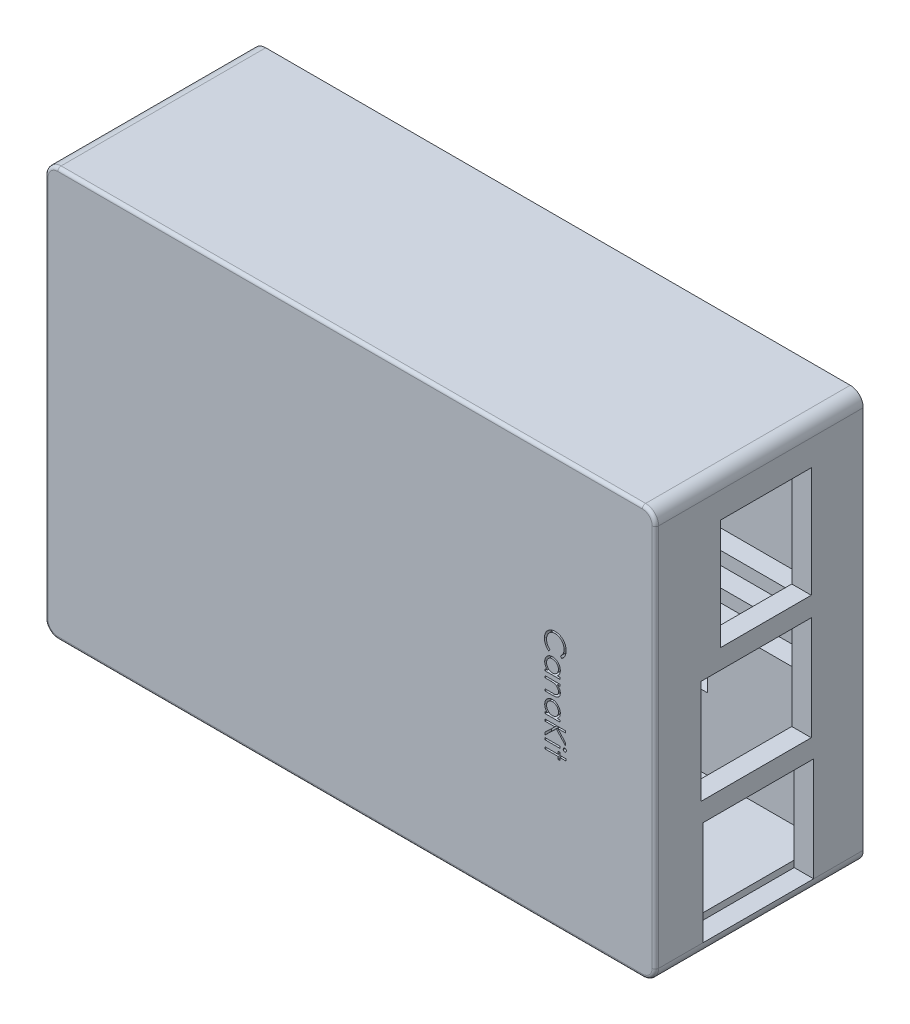
from build123d import *

# Parameters (mm, degrees)
SKETCH1_W           = 94
SKETCH1_H           = 63
BOSS_EXTRUDE1_DEPTH = 32
SHELL1_T            = 3
SKETCH2_W           = 8
SKETCH2_H           = 17
CUT_EXTRUDE1_DEPTH  = 3
SKETCH3_W           = 14
SKETCH3_H           = 17
CUT_EXTRUDE2_DEPTH  = 3
SKETCH4_W           = 17
SKETCH4_H           = 16
CUT_EXTRUDE4_DEPTH  = 3
SKETCH5_W           = 17
SKETCH5_H           = 16
CUT_EXTRUDE5_DEPTH  = 3
SKETCH6_R           = 1.75
CUT_EXTRUDE6_DEPTH  = 3
SKETCH7_W           = 9
SKETCH7_H           = 3
SKETCH7_W_2         = 8
SKETCH7_H_2         = 2.5
CUT_EXTRUDE7_DEPTH  = 3
SKETCH9_W           = 2.320192308
SKETCH9_H           = 0.284935898
CUT_EXTRUDE8_DEPTH  = 1
SKETCH11_W          = 0.237446581
SKETCH11_H          = 2.645833333
SKETCH11_W_2        = 0.237446582
CUT_EXTRUDE9_DEPTH  = 1
SKETCH14_W          = 50
SKETCH14_H          = 3
SKETCH14_W_2        = 60
SKETCH14_W_3        = 76
CUT_EXTRUDE11_DEPTH = 10
FILLET1_R           = 2
FILLET2_R           = 0.5


with BuildPart() as part:
    # Sketch1 → Boss-Extrude1 (new body)
    with BuildSketch(Plane.XY):
        with Locations((47, 31.5)):
            Rectangle(SKETCH1_W, SKETCH1_H)
    extrude(amount=BOSS_EXTRUDE1_DEPTH)

    # Shell1 (no face opened: a closed hollow body)
    add(offset(amount=-SHELL1_T, mode=Mode.PRIVATE), mode=Mode.SUBTRACT)

    # Sketch2 → Cut-Extrude1 (cut)
    with BuildSketch(Plane.ZY):
        with Locations((4, 31.5)):
            Rectangle(SKETCH2_W, SKETCH2_H)
    extrude(amount=-CUT_EXTRUDE1_DEPTH, mode=Mode.SUBTRACT)

    # Sketch3 → Cut-Extrude2 (cut)
    with BuildSketch(Plane(origin=(94, 0, 0), x_dir=(0, 0, -1), z_dir=(1, 0, 0))):
        with Locations((-15, 48.5)):
            Rectangle(SKETCH3_W, SKETCH3_H)
    extrude(amount=-CUT_EXTRUDE2_DEPTH, mode=Mode.SUBTRACT)

    # Sketch4 → Cut-Extrude4 (cut)
    with BuildSketch(Plane(origin=(94, 0, 0), x_dir=(0, 0, -1), z_dir=(1, 0, 0))):
        with Locations((-16.5, 29)):
            Rectangle(SKETCH4_W, SKETCH4_H)
    extrude(amount=-CUT_EXTRUDE4_DEPTH, mode=Mode.SUBTRACT)

    # Sketch5 → Cut-Extrude5 (cut)
    with BuildSketch(Plane(origin=(94, 0, 0), x_dir=(0, 0, -1), z_dir=(1, 0, 0))):
        with Locations((-16.132814298, 10)):
            Rectangle(SKETCH5_W, SKETCH5_H)
    extrude(amount=-CUT_EXTRUDE5_DEPTH, mode=Mode.SUBTRACT)

    # Sketch6 → Cut-Extrude6 (cut)
    with BuildSketch(Plane(origin=(0, 0, 0), x_dir=(-1, 0, 0), z_dir=(0, -1, 0))):
        with Locations(Location((-59, -11, 0), (0, 0, 90))):
            Circle(SKETCH6_R)
    extrude(amount=-CUT_EXTRUDE6_DEPTH, mode=Mode.SUBTRACT)

    # Sketch7 → Cut-Extrude7 (cut)
    with BuildSketch(Plane(origin=(0, 0, 0), x_dir=(-1, 0, 0), z_dir=(0, -1, 0))):
        with Locations((-47.5, -9.5)):
            Rectangle(SKETCH7_W, SKETCH7_H)
        with Locations((-32.5, -9.5)):
            Rectangle(SKETCH7_W, SKETCH7_H)
        with Locations((-18, -9.25)):
            Rectangle(SKETCH7_W_2, SKETCH7_H_2)
    extrude(amount=-CUT_EXTRUDE7_DEPTH, mode=Mode.SUBTRACT)

    # Sketch9 → Cut-Extrude8 (cut)
    # profile 1 of 8: a face of its own
    with BuildSketch(Plane.XY.offset(32)):
        with BuildLine():
            Line((79.592407853, 36.364576199), (79.401602564, 36.61389511))
            add(Edge.make_bspline(
                [(79.401602564, 36.61389511), (79.422798837, 36.631680451), (79.46490561, 36.667011349), (79.524032768, 36.723852197), (79.579427684, 36.783090116), (79.631354246, 36.844702462), (79.677996598, 36.909798235), (79.721785384, 36.976800531), (79.761035404, 37.046830186), (79.808626827, 37.143669259), (79.85828941, 37.270349808), (79.899930199, 37.42982084), (79.92643798, 37.596291622), (79.929308943, 37.709863731), (79.930769231, 37.767631087)],
                knots=[0, 0, 0, 0, 0.757959112, 1.505699292, 2.245454638, 2.979532153, 3.711538275, 4.438200793, 5.171680507, 5.909471876, 7.393775596, 8.890124382, 10.418191784, 12, 12, 12, 12], degree=3))
            add(Edge.make_bspline(
                [(79.930769231, 37.767631087), (79.930401126, 37.799456265), (79.929668331, 37.862811252), (79.920068742, 37.956840934), (79.906421017, 38.049292881), (79.886663101, 38.139823299), (79.860940087, 38.228252435), (79.830773858, 38.315253604), (79.793235048, 38.399802163), (79.751778443, 38.482915634), (79.704940099, 38.562540242), (79.653867717, 38.637894764), (79.599062564, 38.708634942), (79.54066611, 38.774956797), (79.477952603, 38.836132968), (79.411659795, 38.893143893), (79.340989768, 38.944962102), (79.267267879, 38.992860937), (79.190385773, 39.035482334), (79.1108271, 39.072287973), (79.028896043, 39.103833466), (78.944424761, 39.129026049), (78.857745669, 39.148897012), (78.768674814, 39.162624777), (78.677385087, 39.17213801), (78.615509579, 39.172864063), (78.584319912, 39.173230045)],
                knots=[0, 0, 0, 0, 1.055000685, 2.100209969, 3.131349012, 4.153242145, 5.170189196, 6.184191144, 7.204341339, 8.235672124, 9.263040994, 10.265373269, 11.252624173, 12.22887325, 13.193405896, 14.155809299, 15.126090485, 16.097288279, 17.069732292, 18.038585918, 19.002221264, 19.978698174, 20.959418239, 21.948869816, 22.966084182, 24, 24, 24, 24], degree=3))
            add(Edge.make_bspline(
                [(78.584319912, 39.173230045), (78.537392215, 39.172085395), (78.445255905, 39.169838027), (78.310299709, 39.149837038), (78.181013097, 39.119443134), (78.058204241, 39.073890432), (77.940358801, 39.017721007), (77.829470699, 38.946745595), (77.723864244, 38.864543451), (77.626035284, 38.769951656), (77.536669262, 38.666169237), (77.457974091, 38.554819346), (77.392374162, 38.436179314), (77.337785982, 38.311559085), (77.295824522, 38.179999681), (77.26628421, 38.041737682), (77.247014518, 37.897073801), (77.245169672, 37.798222988), (77.244230769, 37.747914541)],
                knots=[0, 0, 0, 0, 1.029171465, 2.020641659, 2.987623507, 3.938342917, 4.889210282, 5.84687017, 6.821220943, 7.821438502, 8.827599549, 9.822697543, 10.807740252, 11.797342354, 12.80366471, 13.83203677, 14.896651826, 16, 16, 16, 16], degree=3))
            add(Edge.make_bspline(
                [(77.244230769, 37.747914541), (77.245762734, 37.692485673), (77.248778006, 37.583388401), (77.274322468, 37.423397406), (77.315740722, 37.270239247), (77.373705266, 37.123905686), (77.449057348, 36.984809257), (77.540404709, 36.852732287), (77.648616268, 36.727563291), (77.731241677, 36.652296485), (77.773397436, 36.61389511)],
                knots=[0, 0, 0, 0, 1.028121516, 2.023589091, 2.998037872, 3.967518031, 4.937445131, 5.927275754, 6.942489185, 8, 8, 8, 8], degree=3))
            Line((77.773397436, 36.61389511), (77.5845002, 36.364576199))
            add(Edge.make_bspline(
                [(77.5845002, 36.364576199), (77.558611703, 36.384640458), (77.506958714, 36.424672869), (77.434141462, 36.489495894), (77.365646064, 36.557781681), (77.302039415, 36.630046279), (77.241993661, 36.705425405), (77.187521789, 36.785246822), (77.136964496, 36.868131861), (77.091284016, 36.95456309), (77.050326453, 37.044256744), (77.015748946, 37.13711948), (76.985534654, 37.232364561), (76.960842027, 37.330039952), (76.941538282, 37.430471959), (76.928641156, 37.533315999), (76.919803267, 37.638789163), (76.91899788, 37.709946769), (76.918589744, 37.746006488)],
                knots=[0, 0, 0, 0, 0.986756325, 1.968786143, 2.935506311, 3.899499537, 4.868307269, 5.8376204, 6.809456583, 7.792545619, 8.781780509, 9.778496008, 10.776623214, 11.79151764, 12.812666265, 13.856269958, 14.913646641, 16, 16, 16, 16], degree=3))
            add(Edge.make_bspline(
                [(76.918589744, 37.746006488), (76.918827408, 37.780154671), (76.919297361, 37.847678476), (76.926910255, 37.947372344), (76.937296803, 38.044427178), (76.952936064, 38.138565588), (76.971391287, 38.230301294), (76.996130213, 38.318802682), (77.023842671, 38.404940622), (77.056413623, 38.488369046), (77.093167589, 38.569158916), (77.134707074, 38.647049659), (77.180682766, 38.722005452), (77.23008124, 38.794763226), (77.284489221, 38.864248177), (77.343151096, 38.931062447), (77.405869149, 38.995580693), (77.451094623, 39.035497414), (77.473833133, 39.055566784)],
                knots=[0, 0, 0, 0, 1.114604814, 2.203992996, 3.262667896, 4.300477797, 5.318619304, 6.316056647, 7.298880507, 8.271930387, 9.238335007, 10.195173496, 11.151986948, 12.108099108, 13.064862484, 14.031167946, 15.010108607, 16, 16, 16, 16], degree=3))
            add(Edge.make_bspline(
                [(77.473833133, 39.055566784), (77.513331212, 39.087711975), (77.591850513, 39.151614272), (77.719109939, 39.233371142), (77.851977528, 39.303354996), (77.991151321, 39.359938867), (78.136319022, 39.404173632), (78.28755381, 39.434818002), (78.444714444, 39.454731243), (78.551609245, 39.457008433), (78.605944511, 39.458165943)],
                knots=[0, 0, 0, 0, 0.994628077, 1.977248131, 2.950237994, 3.925870899, 4.908910175, 5.911660606, 6.938484602, 8, 8, 8, 8], degree=3))
            add(Edge.make_bspline(
                [(78.605944511, 39.458165943), (78.663051712, 39.45674885), (78.775406564, 39.453960809), (78.94033561, 39.43046897), (79.098121922, 39.392219718), (79.249372626, 39.339550243), (79.393222321, 39.270065123), (79.530278547, 39.185947766), (79.660429392, 39.086376549), (79.782010866, 38.972601991), (79.893168603, 38.847802191), (79.990965005, 38.7141647), (80.072351404, 38.571940624), (80.140383692, 38.422699551), (80.19267544, 38.265323221), (80.229281549, 38.100147603), (80.252066361, 37.927483013), (80.254946728, 37.809679242), (80.256410256, 37.749822594)],
                knots=[0, 0, 0, 0, 1.032901378, 2.032168977, 3.007206631, 3.966850309, 4.924221947, 5.891988639, 6.871730993, 7.884084801, 8.900290346, 9.89161143, 10.874607481, 11.860025555, 12.854717796, 13.869097222, 14.917278314, 16, 16, 16, 16], degree=3))
            add(Edge.make_bspline(
                [(80.256410256, 37.749822594), (80.255973215, 37.713342251), (80.255108136, 37.641133087), (80.246661398, 37.534315646), (80.232605758, 37.430314869), (80.213348582, 37.328879244), (80.189745739, 37.229640947), (80.158847794, 37.133618086), (80.122967705, 37.040287782), (80.082697452, 36.949580136), (80.036659325, 36.862482019), (79.986657094, 36.779009281), (79.931536539, 36.70016887), (79.873119948, 36.624477791), (79.809222157, 36.55364009), (79.741924047, 36.48563266), (79.669228646, 36.422804733), (79.618061659, 36.384021241), (79.592407853, 36.364576199)],
                knots=[0, 0, 0, 0, 1.096705196, 2.170817488, 3.219277236, 4.250701065, 5.274195539, 6.284202015, 7.28098643, 8.279664616, 9.266225751, 10.241373748, 11.203306326, 12.157093976, 13.114198862, 14.069774147, 15.032234603, 16, 16, 16, 16], degree=3))
        make_face()
    # profile 2 of 8: a face of its own
    with BuildSketch(Plane.XY.offset(32)):
        with BuildLine():
            Line((79.320192308, 33.433806969), (77, 33.433806969))
            Line((77, 33.433806969), (77, 33.718742866))
            Line((77, 33.718742866), (77.401327123, 33.718742866))
            add(Edge.make_bspline(
                [(77.401327123, 33.718742866), (77.364995688, 33.75086605), (77.294094435, 33.813554849), (77.201743879, 33.918239121), (77.124780832, 34.028742835), (77.063197788, 34.145439663), (77.01658663, 34.267980451), (76.983808313, 34.396015744), (76.962470523, 34.529374903), (76.960362919, 34.62032125), (76.959294872, 34.666409132)],
                knots=[0, 0, 0, 0, 1.074295371, 2.096500925, 3.086030275, 4.053105238, 5.014108356, 5.985331429, 6.979048527, 8, 8, 8, 8], degree=3))
            add(Edge.make_bspline(
                [(76.959294872, 34.666409132), (76.960407182, 34.70738303), (76.962600707, 34.788185371), (76.979623451, 34.907045862), (77.006946428, 35.021435457), (77.044992597, 35.13142706), (77.095199127, 35.236275388), (77.155955963, 35.336571232), (77.227599005, 35.432548666), (77.309821196, 35.5223824), (77.399031733, 35.605211329), (77.494459932, 35.677678276), (77.594795087, 35.739096373), (77.700008999, 35.789571049), (77.810024757, 35.828631), (77.924766887, 35.855806157), (78.044044465, 35.872810557), (78.12526995, 35.875002971), (78.16645633, 35.876114661)],
                knots=[0, 0, 0, 0, 1.034036272, 2.039165313, 3.024406509, 3.999331371, 4.971254918, 5.953351348, 6.95522652, 7.989525907, 9.023492927, 10.024309745, 11.009187477, 11.988246066, 12.964946762, 13.950187958, 14.960617622, 16, 16, 16, 16], degree=3))
            add(Edge.make_bspline(
                [(78.16645633, 35.876114661), (78.206791433, 35.874978314), (78.286531756, 35.872731817), (78.403803519, 35.855988109), (78.516768542, 35.827853322), (78.625008361, 35.788294483), (78.728958893, 35.737792967), (78.827806828, 35.675318617), (78.92306426, 35.602877784), (79.011676453, 35.519163623), (79.093231565, 35.428523599), (79.165048714, 35.33200918), (79.225649774, 35.230823806), (79.274912545, 35.124764585), (79.314059741, 35.014582511), (79.341349107, 34.899440589), (79.357390885, 34.779862438), (79.359717355, 34.69868263), (79.360897436, 34.657504885)],
                knots=[0, 0, 0, 0, 1.02050356, 2.017480486, 2.990790918, 3.96161403, 4.928589988, 5.909588639, 6.91611943, 7.952353252, 8.989586576, 9.99823133, 10.991940466, 11.968822692, 12.952985106, 13.945868367, 14.958059758, 16, 16, 16, 16], degree=3))
            add(Edge.make_bspline(
                [(79.360897436, 34.657504885), (79.35959954, 34.610150313), (79.357054429, 34.517290231), (79.335648743, 34.381289209), (79.299929904, 34.252512878), (79.250839162, 34.130218955), (79.186088065, 34.014881847), (79.103669958, 33.907921046), (79.005467682, 33.807183259), (78.929818802, 33.748796176), (78.890880409, 33.718742866)],
                knots=[0, 0, 0, 0, 1.03879612, 2.037030165, 3.012306674, 3.966139504, 4.922386257, 5.905048148, 6.921675258, 8, 8, 8, 8], degree=3))
            Line((78.890880409, 33.718742866), (79.320192308, 33.718742866))
            Line((79.320192308, 33.718742866), (79.320192308, 33.433806969))
        make_face()
        with BuildLine():
            add(Edge.make_bspline(
                [(79.075961538, 34.653688779), (79.074479612, 34.695339668), (79.071554524, 34.777551898), (79.048718337, 34.898241451), (79.010723893, 35.013734268), (78.958757765, 35.123444511), (78.893429501, 35.225669681), (78.814353247, 35.316942945), (78.724043657, 35.398356292), (78.621741454, 35.465667444), (78.513319241, 35.522417441), (78.399120862, 35.561333849), (78.282314515, 35.587230091), (78.203058982, 35.589859112), (78.163276242, 35.591178763)],
                knots=[0, 0, 0, 0, 1.031093775, 2.03521511, 3.029845951, 4.035119871, 5.034286494, 6.024708811, 7.017619509, 8.03559408, 9.050082311, 10.039808432, 11.016071318, 12, 12, 12, 12], degree=3))
            add(Edge.make_bspline(
                [(78.163276242, 35.591178763), (78.123739082, 35.589471444), (78.044819734, 35.586063497), (77.927666339, 35.562016456), (77.813927693, 35.520351084), (77.704003595, 35.464896412), (77.601491403, 35.396075419), (77.509415819, 35.315337749), (77.430022437, 35.222900584), (77.363570151, 35.120453679), (77.31007922, 35.01120177), (77.272360445, 34.89625621), (77.248543069, 34.777636627), (77.245673038, 34.6968369), (77.244230769, 34.65623285)],
                knots=[0, 0, 0, 0, 0.979154363, 1.954470772, 2.947816011, 3.971783346, 4.997163654, 5.998045606, 6.995988793, 8.00538986, 9.015323546, 10.000094788, 10.994993517, 12, 12, 12, 12], degree=3))
            add(Edge.make_bspline(
                [(77.244230769, 34.65623285), (77.245714042, 34.615001481), (77.248656622, 34.53320494), (77.271874718, 34.412231326), (77.309396751, 34.294652065), (77.36210666, 34.182216186), (77.427132861, 34.077551449), (77.503594937, 33.983732822), (77.591774751, 33.903622309), (77.689464359, 33.836464479), (77.796058113, 33.78341316), (77.910031357, 33.745995378), (78.030488427, 33.723013869), (78.112927573, 33.720186219), (78.155008013, 33.718742866)],
                knots=[0, 0, 0, 0, 1.017484689, 2.018529338, 3.030031036, 4.058138743, 5.076350332, 6.065651025, 7.036469986, 8.00785331, 8.984076697, 9.96571663, 10.961615403, 12, 12, 12, 12], degree=3))
            add(Edge.make_bspline(
                [(78.155008013, 33.718742866), (78.187064461, 33.719613425), (78.250161695, 33.721326961), (78.34280612, 33.734417353), (78.431463925, 33.75524147), (78.516232148, 33.784581448), (78.596628012, 33.823136852), (78.67328171, 33.869589193), (78.745479223, 33.924891278), (78.813129118, 33.987360122), (78.874523952, 34.056508928), (78.928636843, 34.130039722), (78.974431239, 34.2077675), (79.011078734, 34.289637702), (79.040934529, 34.375019758), (79.060653765, 34.464732039), (79.074237276, 34.557870409), (79.075380733, 34.621413033), (79.075961538, 34.653688779)],
                knots=[0, 0, 0, 0, 1.050062701, 2.066855696, 3.059271411, 4.030305351, 4.999747758, 5.975466543, 6.961907836, 7.974539719, 8.98812422, 9.98710676, 10.961662635, 11.93785114, 12.922015094, 13.919620009, 14.94329489, 16, 16, 16, 16], degree=3))
        make_face(mode=Mode.SUBTRACT)
    # profile 3 of 8: a face of its own
    with BuildSketch(Plane.XY.offset(32)):
        with BuildLine():
            Line((79.320192308, 32.782524917), (79.320192308, 32.49758902))
            Line((79.320192308, 32.49758902), (78.901692708, 32.49758902))
            add(Edge.make_bspline(
                [(78.901692708, 32.49758902), (78.939650035, 32.467165594), (79.013307553, 32.408127874), (79.11011836, 32.3098078), (79.189897243, 32.205900119), (79.253491399, 32.097041159), (79.301430838, 31.983083142), (79.33605279, 31.864720712), (79.356812599, 31.741245228), (79.359525165, 31.657276061), (79.360897436, 31.614796552)],
                knots=[0, 0, 0, 0, 1.12780773, 2.188550248, 3.19190651, 4.159438251, 5.104880172, 6.052711206, 7.014878035, 8, 8, 8, 8], degree=3))
            add(Edge.make_bspline(
                [(79.360897436, 31.614796552), (79.359311939, 31.571862065), (79.356208739, 31.487828919), (79.331733941, 31.365458896), (79.289686849, 31.25106759), (79.232671944, 31.144905591), (79.161388453, 31.049412476), (79.077897152, 30.966307542), (78.982598051, 30.896985598), (78.893915897, 30.850576457), (78.815281557, 30.819977568), (78.747928028, 30.800717955), (78.67289119, 30.784360928), (78.590395887, 30.770180807), (78.499864703, 30.760585823), (78.401668573, 30.753018182), (78.295839357, 30.74759465), (78.222645059, 30.747379469), (78.184900841, 30.747268507)],
                knots=[0, 0, 0, 0, 1.235764744, 2.418689688, 3.575570385, 4.733739044, 5.876600945, 6.994686206, 8.113221397, 9.257403329, 9.866223892, 10.540462211, 11.272173464, 12.077110251, 12.949508505, 13.892531187, 14.913238277, 16, 16, 16, 16], degree=3))
            Line((78.184900841, 30.747268507), (77, 30.747268507))
            Line((77, 30.747268507), (77, 31.032204404))
            Line((77, 31.032204404), (78.09140625, 31.032204404))
            add(Edge.make_bspline(
                [(78.09140625, 31.032204404), (78.122995182, 31.032379672), (78.183419433, 31.032714928), (78.269932762, 31.033772336), (78.348388443, 31.036321232), (78.418598912, 31.039902916), (78.48049675, 31.045145322), (78.534208022, 31.050608709), (78.579664536, 31.057289795), (78.607028575, 31.063243295), (78.619300881, 31.065913339)],
                knots=[0, 0, 0, 0, 1.430800155, 2.736877192, 3.918605307, 4.986035426, 5.920637409, 6.731861385, 7.431261377, 8, 8, 8, 8], degree=3))
            add(Edge.make_bspline(
                [(78.619300881, 31.065913339), (78.655324599, 31.075552214), (78.72465911, 31.094104066), (78.818706559, 31.139945608), (78.898714915, 31.197834186), (78.964189512, 31.268498664), (79.015144486, 31.351256468), (79.05049943, 31.445877948), (79.072612189, 31.55145), (79.074813944, 31.625703619), (79.075961538, 31.664405927)],
                knots=[0, 0, 0, 0, 1.084156227, 2.086665306, 3.027808233, 3.945421172, 4.874247719, 5.839848303, 6.874090471, 8, 8, 8, 8], degree=3))
            add(Edge.make_bspline(
                [(79.075961538, 31.664405927), (79.075529895, 31.687327406), (79.074675684, 31.732688421), (79.066099662, 31.799951868), (79.052085413, 31.86520175), (79.033122211, 31.929066782), (79.007317289, 31.990192218), (78.977447743, 32.050364303), (78.940871435, 32.107861022), (78.899887182, 32.163769838), (78.85421131, 32.215723112), (78.806720377, 32.264756865), (78.755415002, 32.307838312), (78.702111953, 32.346944432), (78.645739749, 32.380660736), (78.586901169, 32.41010292), (78.525503092, 32.435081034), (78.482890095, 32.447493284), (78.46156851, 32.453703804)],
                knots=[0, 0, 0, 0, 1.02388931, 2.02625049, 3.024079426, 4.004119353, 4.998163158, 5.985366248, 7.002659681, 8.039138713, 9.080111048, 10.09169763, 11.086418407, 12.069932368, 13.043171485, 14.017654831, 15.008125612, 16, 16, 16, 16], degree=3))
            add(Edge.make_bspline(
                [(78.46156851, 32.453703804), (78.445915575, 32.457277628), (78.411839956, 32.465057656), (78.355919662, 32.473460683), (78.291231327, 32.481087555), (78.21785044, 32.487471082), (78.135520082, 32.49137671), (78.044591857, 32.495635198), (77.944703193, 32.497185561), (77.875160086, 32.497450767), (77.838907252, 32.49758902)],
                knots=[0, 0, 0, 0, 0.615963638, 1.340920617, 2.168419149, 3.115676021, 4.16674242, 5.331190069, 6.6087489, 8, 8, 8, 8], degree=3))
            Line((77.838907252, 32.49758902), (77, 32.49758902))
            Line((77, 32.49758902), (77, 32.782524917))
            Line((77, 32.782524917), (79.320192308, 32.782524917))
        make_face()
    # profile 4 of 8: a face of its own
    with BuildSketch(Plane.XY.offset(32)):
        with BuildLine():
            Line((79.320192308, 27.73508902), (77, 27.73508902))
            Line((77, 27.73508902), (77, 28.020024917))
            Line((77, 28.020024917), (77.401327123, 28.020024917))
            add(Edge.make_bspline(
                [(77.401327123, 28.020024917), (77.364995688, 28.052148102), (77.294094435, 28.1148369), (77.201743879, 28.219521173), (77.124780832, 28.330024887), (77.063197788, 28.446721714), (77.01658663, 28.569262502), (76.983808313, 28.697297795), (76.962470523, 28.830656954), (76.960362919, 28.921603301), (76.959294872, 28.967691183)],
                knots=[0, 0, 0, 0, 1.074295371, 2.096500925, 3.086030275, 4.053105238, 5.014108356, 5.985331429, 6.979048527, 8, 8, 8, 8], degree=3))
            add(Edge.make_bspline(
                [(76.959294872, 28.967691183), (76.960407182, 29.008665081), (76.962600707, 29.089467423), (76.979623451, 29.208327913), (77.006946428, 29.322717508), (77.044992597, 29.432709111), (77.095199127, 29.537557439), (77.155955963, 29.637853283), (77.227599005, 29.733830718), (77.309821196, 29.823664452), (77.399031733, 29.90649338), (77.494459932, 29.978960327), (77.594795087, 30.040378424), (77.700008999, 30.0908531), (77.810024757, 30.129913051), (77.924766887, 30.157088208), (78.044044465, 30.174092608), (78.12526995, 30.176285022), (78.16645633, 30.177396712)],
                knots=[0, 0, 0, 0, 1.034036272, 2.039165313, 3.024406509, 3.999331371, 4.971254918, 5.953351348, 6.95522652, 7.989525907, 9.023492927, 10.024309745, 11.009187477, 11.988246066, 12.964946762, 13.950187958, 14.960617622, 16, 16, 16, 16], degree=3))
            add(Edge.make_bspline(
                [(78.16645633, 30.177396712), (78.206791433, 30.176260365), (78.286531756, 30.174013868), (78.403803519, 30.15727016), (78.516768542, 30.129135373), (78.625008361, 30.089576534), (78.728958893, 30.039075018), (78.827806828, 29.976600669), (78.92306426, 29.904159835), (79.011676453, 29.820445675), (79.093231565, 29.72980565), (79.165048714, 29.633291232), (79.225649774, 29.532105857), (79.274912545, 29.426046637), (79.314059741, 29.315864562), (79.341349107, 29.20072264), (79.357390885, 29.081144489), (79.359717355, 28.999964681), (79.360897436, 28.958786937)],
                knots=[0, 0, 0, 0, 1.02050356, 2.017480486, 2.990790918, 3.96161403, 4.928589988, 5.909588639, 6.91611943, 7.952353252, 8.989586576, 9.99823133, 10.991940466, 11.968822692, 12.952985106, 13.945868367, 14.958059758, 16, 16, 16, 16], degree=3))
            add(Edge.make_bspline(
                [(79.360897436, 28.958786937), (79.35959954, 28.911432364), (79.357054429, 28.818572282), (79.335648743, 28.68257126), (79.299929904, 28.55379493), (79.250839162, 28.431501006), (79.186088065, 28.316163898), (79.103669958, 28.209203097), (79.005467682, 28.10846531), (78.929818802, 28.050078227), (78.890880409, 28.020024917)],
                knots=[0, 0, 0, 0, 1.03879612, 2.037030165, 3.012306674, 3.966139504, 4.922386257, 5.905048148, 6.921675258, 8, 8, 8, 8], degree=3))
            Line((78.890880409, 28.020024917), (79.320192308, 28.020024917))
            Line((79.320192308, 28.020024917), (79.320192308, 27.73508902))
        make_face()
        with BuildLine():
            add(Edge.make_bspline(
                [(79.075961538, 28.954970831), (79.074479612, 28.996621719), (79.071554524, 29.078833949), (79.048718337, 29.199523503), (79.010723893, 29.315016319), (78.958757765, 29.424726562), (78.893429501, 29.526951732), (78.814353247, 29.618224996), (78.724043657, 29.699638344), (78.621741454, 29.766949495), (78.513319241, 29.823699492), (78.399120862, 29.862615901), (78.282314515, 29.888512142), (78.203058982, 29.891141163), (78.163276242, 29.892460815)],
                knots=[0, 0, 0, 0, 1.031093775, 2.03521511, 3.029845951, 4.035119871, 5.034286494, 6.024708811, 7.017619509, 8.03559408, 9.050082311, 10.039808432, 11.016071318, 12, 12, 12, 12], degree=3))
            add(Edge.make_bspline(
                [(78.163276242, 29.892460815), (78.123739082, 29.890753495), (78.044819734, 29.887345549), (77.927666339, 29.863298507), (77.813927693, 29.821633136), (77.704003595, 29.766178463), (77.601491403, 29.69735747), (77.509415819, 29.616619801), (77.430022437, 29.524182636), (77.363570151, 29.421735731), (77.31007922, 29.312483821), (77.272360445, 29.197538261), (77.248543069, 29.078918679), (77.245673038, 28.998118951), (77.244230769, 28.957514901)],
                knots=[0, 0, 0, 0, 0.979154363, 1.954470772, 2.947816011, 3.971783346, 4.997163654, 5.998045606, 6.995988793, 8.00538986, 9.015323546, 10.000094788, 10.994993517, 12, 12, 12, 12], degree=3))
            add(Edge.make_bspline(
                [(77.244230769, 28.957514901), (77.245714042, 28.916283532), (77.248656622, 28.834486992), (77.271874718, 28.713513377), (77.309396751, 28.595934116), (77.36210666, 28.483498238), (77.427132861, 28.3788335), (77.503594937, 28.285014874), (77.591774751, 28.20490436), (77.689464359, 28.137746531), (77.796058113, 28.084695211), (77.910031357, 28.047277429), (78.030488427, 28.024295921), (78.112927573, 28.02146827), (78.155008013, 28.020024917)],
                knots=[0, 0, 0, 0, 1.017484689, 2.018529338, 3.030031036, 4.058138743, 5.076350332, 6.065651025, 7.036469986, 8.00785331, 8.984076697, 9.96571663, 10.961615403, 12, 12, 12, 12], degree=3))
            add(Edge.make_bspline(
                [(78.155008013, 28.020024917), (78.187064461, 28.020895476), (78.250161695, 28.022609012), (78.34280612, 28.035699404), (78.431463925, 28.056523521), (78.516232148, 28.085863499), (78.596628012, 28.124418903), (78.67328171, 28.170871244), (78.745479223, 28.226173329), (78.813129118, 28.288642174), (78.874523952, 28.35779098), (78.928636843, 28.431321773), (78.974431239, 28.509049551), (79.011078734, 28.590919753), (79.040934529, 28.676301809), (79.060653765, 28.76601409), (79.074237276, 28.85915246), (79.075380733, 28.922695085), (79.075961538, 28.954970831)],
                knots=[0, 0, 0, 0, 1.050062701, 2.066855696, 3.059271411, 4.030305351, 4.999747758, 5.975466543, 6.961907836, 7.974539719, 8.98812422, 9.98710676, 10.961662635, 11.93785114, 12.922015094, 13.919620009, 14.94329489, 16, 16, 16, 16], degree=3))
        make_face(mode=Mode.SUBTRACT)
    # profile 5 of 8: a face of its own
    with BuildSketch(Plane.XY.offset(32)):
        Polygon((80.175, 27.002396712), (80.175, 26.717460815), (78.965930489, 26.717460815), (80.175, 25.39390813), (80.175, 24.987492866), (78.750320513, 26.547644108), (77, 24.865377481), (77, 25.245080005), (78.532166466, 26.717460815), (77, 26.717460815), (77, 27.002396712), align=None)
    # profile 6 of 8: a face of its own
    with BuildSketch(Plane.XY.offset(32)):
        with BuildLine():
            add(Edge.make_bspline(
                [(80.297115385, 24.378187978), (80.296291631, 24.360509523), (80.294678565, 24.325891711), (80.280975474, 24.275781599), (80.257393594, 24.230198762), (80.226783738, 24.189164526), (80.189305024, 24.15514903), (80.146720919, 24.13075811), (80.100361492, 24.11518702), (80.068059231, 24.113295616), (80.05161258, 24.11233261)],
                knots=[0, 0, 0, 0, 1.054986045, 2.065865298, 3.074122704, 4.105114675, 5.109626121, 6.074217918, 7.019490725, 8, 8, 8, 8], degree=3))
            add(Edge.make_bspline(
                [(80.05161258, 24.11233261), (80.035592833, 24.113317159), (80.003923688, 24.115263496), (79.958368075, 24.130746599), (79.916376945, 24.155353519), (79.878971504, 24.189141886), (79.848379332, 24.230204742), (79.82479278, 24.275780017), (79.811090923, 24.325892127), (79.809477686, 24.360509663), (79.808653846, 24.378187978)],
                knots=[0, 0, 0, 0, 0.961106377, 1.899993565, 2.859409042, 3.870007927, 4.90724781, 5.921615355, 6.938620636, 8, 8, 8, 8], degree=3))
            add(Edge.make_bspline(
                [(79.808653846, 24.378187978), (79.809451227, 24.395663254), (79.811003226, 24.429676594), (79.824956711, 24.478865329), (79.848328041, 24.523714721), (79.879394858, 24.564077894), (79.916128223, 24.598536163), (79.958399793, 24.623052291), (80.003915612, 24.638576791), (80.03559012, 24.640517549), (80.05161258, 24.641499276)],
                knots=[0, 0, 0, 0, 1.055304112, 2.054011575, 3.063363921, 4.096942562, 5.122536081, 6.088009498, 7.032825006, 8, 8, 8, 8], degree=3))
            add(Edge.make_bspline(
                [(80.05161258, 24.641499276), (80.068062047, 24.640539197), (80.100369838, 24.638653541), (80.146688658, 24.623040241), (80.189555867, 24.598743174), (80.226360691, 24.564055629), (80.257444772, 24.52372055), (80.280811588, 24.478863811), (80.294766253, 24.429676997), (80.296318087, 24.39566339), (80.297115385, 24.378187978)],
                knots=[0, 0, 0, 0, 0.986662878, 1.937868148, 2.908513651, 3.927890639, 4.955204348, 5.958438607, 6.951092507, 8, 8, 8, 8], degree=3))
        make_face()
    # profile 7 of 8: a face of its own
    with BuildSketch(Plane.XY.offset(32)):
        with Locations((78.160096154, 24.376915943)):
            Rectangle(SKETCH9_W, SKETCH9_H)
    # profile 8 of 8: a face of its own
    with BuildSketch(Plane.XY.offset(32)):
        Polygon((80.256410256, 23.298230045), (80.256410256, 23.013294148), (79.320192308, 23.013294148), (79.320192308, 22.606242866), (79.03525641, 22.606242866), (79.03525641, 23.013294148), (77, 23.013294148), (77, 23.298230045), (79.03525641, 23.298230045), (79.03525641, 23.705281328), (79.320192308, 23.705281328), (79.320192308, 23.298230045), align=None)
    extrude(amount=-CUT_EXTRUDE8_DEPTH, mode=Mode.SUBTRACT)

    # Sketch11 → Cut-Extrude9 (cut)
    # profile 1 of 14: a face of its own
    with BuildSketch(Plane.XZ):
        with BuildLine():
            Line((13.568376068, 2.645833333), (14.08726045, 2.645833333))
            add(Edge.make_bspline(
                [(14.08726045, 2.645833333), (14.122949647, 2.645794102), (14.191331733, 2.645718934), (14.289390138, 2.643439929), (14.378448686, 2.640395942), (14.458315343, 2.636176297), (14.529235845, 2.631189588), (14.59088928, 2.624195487), (14.643760254, 2.616892764), (14.675439534, 2.609468248), (14.689887153, 2.606082232)],
                knots=[0, 0, 0, 0, 1.415646017, 2.712440637, 3.8905458, 4.950247383, 5.884950622, 6.709939814, 7.411656543, 8, 8, 8, 8], degree=3))
            add(Edge.make_bspline(
                [(14.689887153, 2.606082232), (14.708176312, 2.601076353), (14.74432367, 2.591182553), (14.796409578, 2.571366226), (14.845965163, 2.547869589), (14.893160448, 2.521090777), (14.937415476, 2.489880857), (14.979390518, 2.455504967), (15.018715146, 2.417169436), (15.055168222, 2.375304234), (15.088645421, 2.330612171), (15.117469645, 2.28242608), (15.141605108, 2.231557059), (15.162305558, 2.178040491), (15.177204211, 2.121426972), (15.18842776, 2.062109874), (15.195551574, 2.000095555), (15.196233867, 1.957716964), (15.196581197, 1.936143663)],
                knots=[0, 0, 0, 0, 0.999701418, 1.975846123, 2.934577507, 3.890451536, 4.834027766, 5.787354733, 6.749476667, 7.726910423, 8.712836071, 9.690891519, 10.682875813, 11.679750201, 12.712814741, 13.765529915, 14.8625177, 16, 16, 16, 16], degree=3))
            add(Edge.make_bspline(
                [(15.196581197, 1.936143663), (15.19626262, 1.914389034), (15.195639302, 1.871824634), (15.188158182, 1.809554728), (15.178081192, 1.750047374), (15.162586396, 1.693434515), (15.142292346, 1.640052356), (15.118485853, 1.589085115), (15.089772113, 1.541399887), (15.0567787, 1.496823554), (15.020076007, 1.455314275), (14.979819321, 1.417172853), (14.936171166, 1.382622549), (14.889270256, 1.351585908), (14.838659358, 1.32478265), (14.785106064, 1.300775639), (14.728144888, 1.280613587), (14.688727631, 1.270007529), (14.668686565, 1.264615051)],
                knots=[0, 0, 0, 0, 1.121902311, 2.195077645, 3.232258892, 4.234102512, 5.217864754, 6.176164875, 7.132989551, 8.084763148, 9.034132444, 9.988522005, 10.94243251, 11.903244335, 12.886203696, 13.894208494, 14.929344452, 16, 16, 16, 16], degree=3))
            add(Edge.make_bspline(
                [(14.668686565, 1.264615051), (14.652110545, 1.261090059), (14.615783232, 1.253364835), (14.555955103, 1.244740585), (14.486297579, 1.237379422), (14.406905737, 1.23186011), (14.317850838, 1.227135129), (14.219084709, 1.223379487), (14.110413472, 1.221315847), (14.034613187, 1.221209415), (13.995037894, 1.221153846)],
                knots=[0, 0, 0, 0, 0.601384939, 1.31797006, 2.144135048, 3.087295005, 4.142315834, 5.309527816, 6.595305764, 8, 8, 8, 8], degree=3))
            Line((13.995037894, 1.221153846), (13.80582265, 1.221153846))
            Line((13.80582265, 1.221153846), (13.80582265, 0))
            Line((13.80582265, 0), (13.568376068, 0))
            Line((13.568376068, 0), (13.568376068, 2.645833333))
        make_face()
        with BuildLine():
            Line((13.80582265, 2.374465812), (13.80582265, 1.492521368))
            Line((13.80582265, 1.492521368), (14.269055489, 1.486691206))
            add(Edge.make_bspline(
                [(14.269055489, 1.486691206), (14.291673528, 1.486679516), (14.335337186, 1.486656949), (14.398410998, 1.489669589), (14.456928733, 1.493147372), (14.510710644, 1.49823941), (14.559780975, 1.505437027), (14.604221548, 1.512703043), (14.643687768, 1.523214835), (14.689875855, 1.537368584), (14.741343623, 1.56150812), (14.797335163, 1.59654643), (14.844786737, 1.641208632), (14.885848783, 1.69142491), (14.918434774, 1.747289132), (14.942289602, 1.807061483), (14.956305834, 1.870128965), (14.958185278, 1.913284879), (14.959134615, 1.935083634)],
                knots=[0, 0, 0, 0, 1.160613943, 2.240541288, 3.23993089, 4.169200891, 5.011653406, 5.7853311, 6.478053781, 7.106038997, 8.262395093, 9.384106736, 10.481365981, 11.59014053, 12.70357646, 13.786202915, 14.881775077, 16, 16, 16, 16], degree=3))
            add(Edge.make_bspline(
                [(14.959134615, 1.935083634), (14.958180115, 1.95635501), (14.956282686, 1.998639873), (14.942179741, 2.060611913), (14.918481153, 2.11975438), (14.885630037, 2.174918557), (14.845760254, 2.224954141), (14.79942087, 2.268419231), (14.746720964, 2.303360638), (14.697698789, 2.325913178), (14.654155036, 2.339683059), (14.616333256, 2.349317551), (14.573628996, 2.357009825), (14.526028354, 2.363238497), (14.473900271, 2.368570577), (14.416796902, 2.372188548), (14.354934564, 2.374306316), (14.311988478, 2.374411359), (14.289726062, 2.374465812)],
                knots=[0, 0, 0, 0, 1.120700087, 2.227813068, 3.331159281, 4.466773991, 5.599788987, 6.693661531, 7.80175334, 8.91857717, 9.525282508, 10.207424825, 10.974604443, 11.810962634, 12.737642355, 13.736264703, 14.826523623, 16, 16, 16, 16], degree=3))
            Line((14.289726062, 2.374465812), (13.80582265, 2.374465812))
        make_face(mode=Mode.SUBTRACT)
    # profile 2 of 14: a face of its own
    with BuildSketch(Plane.XZ):
        Polygon((15.569711538, 2.645833333), (15.81510834, 2.645833333), (16.332932692, 0.705449553), (17.103044037, 2.645833333), (17.137494992, 2.645833333), (17.89329594, 0.71869992), (18.413770366, 2.645833333), (18.656517094, 2.645833333), (17.943117321, 0), (17.909196381, 0), (17.113114316, 2.023596087), (16.307491987, 0), (16.273571047, 0), align=None)
    # profile 3 of 14: a face of its own
    with BuildSketch(Plane.XZ):
        with BuildLine():
            Line((19.131410256, 2.645833333), (19.660894932, 2.645833333))
            add(Edge.make_bspline(
                [(19.660894932, 2.645833333), (19.696228999, 2.645715718), (19.764074323, 2.645489883), (19.861269593, 2.644230645), (19.949585315, 2.64062146), (20.028975312, 2.637515566), (20.099438129, 2.631852015), (20.161189831, 2.626438907), (20.213946007, 2.619352866), (20.245881859, 2.612771981), (20.260341546, 2.609792334)],
                knots=[0, 0, 0, 0, 1.410062039, 2.707475311, 3.878576406, 4.937260626, 5.877586885, 6.699081471, 7.410979367, 8, 8, 8, 8], degree=3))
            add(Edge.make_bspline(
                [(20.260341546, 2.609792334), (20.279698935, 2.605009601), (20.318000766, 2.595546163), (20.373147542, 2.575543965), (20.425697061, 2.552396987), (20.475431035, 2.525210127), (20.522100354, 2.493781573), (20.56618622, 2.458653885), (20.607888683, 2.420019271), (20.645521225, 2.376903647), (20.681004913, 2.331670095), (20.710932029, 2.282757136), (20.736730023, 2.231608243), (20.75726964, 2.177703231), (20.773808346, 2.121564868), (20.785469848, 2.062684646), (20.792463306, 2.001330814), (20.793175304, 1.959482871), (20.793536325, 1.938263722)],
                knots=[0, 0, 0, 0, 1.027469482, 2.033020251, 3.019912614, 3.986113645, 4.951240523, 5.91722682, 6.890402269, 7.87763091, 8.8651537, 9.85103654, 10.82876324, 11.815024772, 12.821070561, 13.842952187, 14.906261191, 16, 16, 16, 16], degree=3))
            add(Edge.make_bspline(
                [(20.793536325, 1.938263722), (20.792425832, 1.903009804), (20.790258973, 1.834220278), (20.770056068, 1.73438854), (20.736963103, 1.641263284), (20.691361569, 1.554961766), (20.633289704, 1.477166219), (20.563496558, 1.408835339), (20.481943197, 1.351655167), (20.406023417, 1.312003345), (20.338959706, 1.286608705), (20.283749999, 1.268740744), (20.223525558, 1.254935567), (20.158863406, 1.242568087), (20.089494453, 1.233230794), (20.015584958, 1.226391999), (19.937082213, 1.222117808), (19.883153274, 1.221481292), (19.855410323, 1.221153846)],
                knots=[0, 0, 0, 0, 1.260483769, 2.459530307, 3.627416485, 4.787058657, 5.939039949, 7.08810263, 8.267026773, 9.491475466, 10.141966685, 10.831826277, 11.566392101, 12.351337768, 13.187381173, 14.07005841, 15.007169909, 16, 16, 16, 16], degree=3))
            Line((19.855410323, 1.221153846), (20.827457265, 0))
            Line((20.827457265, 0), (20.533829127, 0))
            Line((20.533829127, 0), (19.561782185, 1.221153846))
            Line((19.561782185, 1.221153846), (19.368856838, 1.221153846))
            Line((19.368856838, 1.221153846), (19.368856838, 0))
            Line((19.368856838, 0), (19.131410256, 0))
            Line((19.131410256, 0), (19.131410256, 2.645833333))
        make_face()
        with BuildLine():
            Line((19.368856838, 2.374465812), (19.368856838, 1.492521368))
            Line((19.368856838, 1.492521368), (19.853290264, 1.488811265))
            add(Edge.make_bspline(
                [(19.853290264, 1.488811265), (19.875908389, 1.488801258), (19.919748757, 1.488781863), (19.983173664, 1.491800968), (20.042228748, 1.4952355), (20.096688127, 1.500488875), (20.146576127, 1.507259238), (20.191867814, 1.515728161), (20.232637121, 1.525594899), (20.280185421, 1.540866366), (20.333280894, 1.565061392), (20.390983843, 1.600262691), (20.440122515, 1.644538156), (20.481637804, 1.6951669), (20.514997553, 1.750832398), (20.538516784, 1.810867391), (20.553441131, 1.873756277), (20.5552014, 1.916980204), (20.556089744, 1.938793737)],
                knots=[0, 0, 0, 0, 1.146690395, 2.22261258, 3.21895312, 4.145990853, 4.996080663, 5.770904154, 6.481378293, 7.121626537, 8.300444488, 9.431385265, 10.535395872, 11.636531494, 12.74115979, 13.810798291, 14.895190096, 16, 16, 16, 16], degree=3))
            add(Edge.make_bspline(
                [(20.556089744, 1.938793737), (20.555180997, 1.960071206), (20.553380194, 2.002235387), (20.538677851, 2.063963366), (20.513815045, 2.122222311), (20.480309543, 2.176775225), (20.439488754, 2.226294442), (20.391623502, 2.268663421), (20.338022551, 2.303625814), (20.287924681, 2.325967518), (20.243146437, 2.339665264), (20.204268063, 2.349304537), (20.160338553, 2.357048868), (20.111144605, 2.363253771), (20.05689623, 2.368586973), (19.99731913, 2.372179091), (19.932808588, 2.374306238), (19.888096325, 2.374411383), (19.864950588, 2.374465812)],
                knots=[0, 0, 0, 0, 1.101028733, 2.181837193, 3.264309656, 4.369019818, 5.486613113, 6.575447106, 7.666700264, 8.788928104, 9.402425223, 10.0903467, 10.862060571, 11.710948788, 12.657782767, 13.684531032, 14.801375019, 16, 16, 16, 16], degree=3))
            Line((19.864950588, 2.374465812), (19.368856838, 2.374465812))
        make_face(mode=Mode.SUBTRACT)
    # profile 4 of 14: a face of its own
    with BuildSketch(Plane.XZ):
        Polygon((28.493589744, 2.645833333), (28.731036325, 2.645833333), (28.731036325, 1.560363248), (30.087873932, 1.560363248), (30.087873932, 2.645833333), (30.325320513, 2.645833333), (30.325320513, 0), (30.087873932, 0), (30.087873932, 1.288995726), (28.731036325, 1.288995726), (28.731036325, 0), (28.493589744, 0), align=None)
    # profile 5 of 14: a face of its own
    with BuildSketch(Plane.XZ):
        with BuildLine():
            Line((31.003739316, 0), (31.003739316, 2.645833333))
            Line((31.003739316, 2.645833333), (31.537994124, 2.645833333))
            add(Edge.make_bspline(
                [(31.537994124, 2.645833333), (31.584461752, 2.645498771), (31.674236967, 2.6448524), (31.803967806, 2.640754086), (31.924000769, 2.633504151), (32.033941085, 2.622943854), (32.134090573, 2.609976978), (32.224168806, 2.593723696), (32.304641557, 2.574531448), (32.354133337, 2.558168518), (32.377537393, 2.550430689)],
                knots=[0, 0, 0, 0, 1.314313732, 2.53924729, 3.670748893, 4.714932338, 5.66265055, 6.526160246, 7.303039223, 8, 8, 8, 8], degree=3))
            add(Edge.make_bspline(
                [(32.377537393, 2.550430689), (32.408149488, 2.53876581), (32.468679496, 2.515700574), (32.554863452, 2.472190751), (32.635996316, 2.422892751), (32.712513169, 2.367741593), (32.782666175, 2.305175687), (32.849195954, 2.237852771), (32.909380894, 2.16332468), (32.964496094, 2.083137041), (33.014189122, 1.998234477), (33.057383605, 1.90877877), (33.093256564, 1.815224214), (33.123035967, 1.717830977), (33.146505611, 1.616384906), (33.162518143, 1.510767876), (33.173079546, 1.401397299), (33.174140942, 1.327182079), (33.174679487, 1.289525741)],
                knots=[0, 0, 0, 0, 0.984719456, 1.947108742, 2.898477687, 3.838006223, 4.779231079, 5.722358779, 6.681677486, 7.655904652, 8.64651281, 9.637519902, 10.640069247, 11.656948941, 12.698408672, 13.768548281, 14.867775369, 16, 16, 16, 16], degree=3))
            add(Edge.make_bspline(
                [(33.174679487, 1.289525741), (33.174204018, 1.256822305), (33.173267055, 1.192376768), (33.164853823, 1.097398234), (33.152625295, 1.005237379), (33.133693074, 0.91633307), (33.110710222, 0.829906382), (33.081255179, 0.746878435), (33.047512869, 0.666487579), (33.008165639, 0.589820797), (32.964969473, 0.517186343), (32.918613156, 0.448715557), (32.86914613, 0.385385478), (32.816096693, 0.327004325), (32.760150384, 0.273660108), (32.700940919, 0.224907216), (32.638315518, 0.181699582), (32.572554674, 0.142339328), (32.501739981, 0.108003702), (32.42453013, 0.078952444), (32.340595847, 0.05487792), (32.250143153, 0.034791588), (32.153015762, 0.01885815), (32.049118449, 0.00817927), (31.938610843, 0.000957708), (31.862728898, 0.000325435), (31.823672042, 0)],
                knots=[0, 0, 0, 0, 1.105936401, 2.179363191, 3.223086493, 4.248585256, 5.251745608, 6.245858792, 7.225916811, 8.198733463, 9.158002045, 10.082870192, 10.993790845, 11.873723703, 12.748670949, 13.606408763, 14.465103618, 15.319838547, 16.196477973, 17.123216899, 18.106603292, 19.147568657, 20.255746949, 21.433717677, 22.679120308, 24, 24, 24, 24], degree=3))
            Line((31.823672042, 0), (31.003739316, 0))
        make_face()
        with BuildLine():
            Line((31.241185897, 0.271367521), (31.544884315, 0.271367521))
            add(Edge.make_bspline(
                [(31.544884315, 0.271367521), (31.588524214, 0.27155507), (31.672459723, 0.271915796), (31.793153566, 0.275081122), (31.903431443, 0.280253301), (32.003309012, 0.287491604), (32.092729882, 0.297068474), (32.171880931, 0.307746228), (32.240502704, 0.321049062), (32.282026742, 0.333107228), (32.301215278, 0.338679387)],
                knots=[0, 0, 0, 0, 1.375205317, 2.645023457, 3.804390687, 4.853969522, 5.800190428, 6.637939096, 7.370582563, 8, 8, 8, 8], degree=3))
            add(Edge.make_bspline(
                [(32.301215278, 0.338679387), (32.325366718, 0.347185029), (32.373092742, 0.363993157), (32.441794515, 0.394652817), (32.505866774, 0.430970334), (32.566426139, 0.47133991), (32.622613551, 0.5171854), (32.675094877, 0.567509897), (32.723764453, 0.622569519), (32.768119436, 0.682295927), (32.807813213, 0.74631738), (32.842187297, 0.814004474), (32.872313158, 0.884615575), (32.895958284, 0.959234998), (32.914490898, 1.037195655), (32.927617776, 1.118503031), (32.935793192, 1.20314194), (32.936746787, 1.26070932), (32.937232906, 1.290055756)],
                knots=[0, 0, 0, 0, 0.998632004, 1.973411704, 2.929992603, 3.868527914, 4.809262121, 5.754881198, 6.702106254, 7.672490631, 8.653608572, 9.636854334, 10.631411391, 11.644891563, 12.686317036, 13.754757253, 14.855430412, 16, 16, 16, 16], degree=3))
            add(Edge.make_bspline(
                [(32.937232906, 1.290055756), (32.936844885, 1.320999518), (32.936082615, 1.381788812), (32.92650144, 1.470984159), (32.912500026, 1.556770127), (32.892252835, 1.639152453), (32.866451515, 1.718291862), (32.834251995, 1.793750659), (32.797462348, 1.866325768), (32.753690182, 1.934342104), (32.705751014, 1.998668442), (32.652548688, 2.057598646), (32.594928457, 2.111266957), (32.533518779, 2.160509175), (32.466588948, 2.203344216), (32.395715622, 2.241660933), (32.319859073, 2.274178899), (32.267083999, 2.291474229), (32.240263588, 2.300263755)],
                knots=[0, 0, 0, 0, 1.122418816, 2.205001699, 3.251619955, 4.274784885, 5.280384055, 6.268708349, 7.249350384, 8.229342522, 9.199999885, 10.157847722, 11.105861043, 12.055065948, 13.010012805, 13.98527497, 14.976112212, 16, 16, 16, 16], degree=3))
            add(Edge.make_bspline(
                [(32.240263588, 2.300263755), (32.218075519, 2.306399388), (32.170897597, 2.319445427), (32.093911812, 2.333676513), (32.007268217, 2.346228723), (31.910582133, 2.356855932), (31.803963774, 2.364481466), (31.687331141, 2.370205019), (31.560633821, 2.37406539), (31.472805358, 2.374328996), (31.427221054, 2.374465812)],
                knots=[0, 0, 0, 0, 0.674548936, 1.434276114, 2.292660221, 3.240891867, 4.284742987, 5.42552168, 6.663806718, 8, 8, 8, 8], degree=3))
            Line((31.427221054, 2.374465812), (31.241185897, 2.374465812))
            Line((31.241185897, 2.374465812), (31.241185897, 0.271367521))
        make_face(mode=Mode.SUBTRACT)
    # profile 6 of 14: a face of its own
    with BuildSketch(Plane.XZ):
        Polygon((33.581730769, 0), (33.93101045, 2.645833333), (33.96493139, 2.645833333), (35.057291667, 0.474893162), (36.14700187, 2.645833333), (36.181452825, 2.645833333), (36.532852564, 0), (36.294345954, 0), (36.040998932, 1.903812767), (35.08591246, 0), (35.032380976, 0), (34.073584402, 1.908052885), (33.820767394, 0), align=None)
    # profile 7 of 14: a face of its own
    with BuildSketch(Plane.XZ):
        with Locations((37.194310898, 1.322916667)):
            Rectangle(SKETCH11_W, SKETCH11_H)
    # profile 8 of 14: a face of its own
    with BuildSketch(Plane.XZ):
        Polygon((43.079594017, 2.645833333), (43.317040598, 2.645833333), (43.317040598, 1.560363248), (44.673878205, 1.560363248), (44.673878205, 2.645833333), (44.911324786, 2.645833333), (44.911324786, 0), (44.673878205, 0), (44.673878205, 1.288995726), (43.317040598, 1.288995726), (43.317040598, 0), (43.079594017, 0), align=None)
    # profile 9 of 14: a face of its own
    with BuildSketch(Plane.XZ):
        with BuildLine():
            Line((45.58974359, 0), (45.58974359, 2.645833333))
            Line((45.58974359, 2.645833333), (46.123998397, 2.645833333))
            add(Edge.make_bspline(
                [(46.123998397, 2.645833333), (46.170466025, 2.645498771), (46.260241241, 2.6448524), (46.389972079, 2.640754086), (46.510005042, 2.633504151), (46.619945359, 2.622943854), (46.720094846, 2.609976978), (46.81017308, 2.593723696), (46.890645831, 2.574531448), (46.94013761, 2.558168518), (46.963541667, 2.550430689)],
                knots=[0, 0, 0, 0, 1.314313732, 2.53924729, 3.670748893, 4.714932338, 5.66265055, 6.526160246, 7.303039223, 8, 8, 8, 8], degree=3))
            add(Edge.make_bspline(
                [(46.963541667, 2.550430689), (46.994153761, 2.53876581), (47.05468377, 2.515700574), (47.140867725, 2.472190751), (47.222000589, 2.422892751), (47.298517443, 2.367741593), (47.368670448, 2.305175687), (47.435200227, 2.237852771), (47.495385167, 2.16332468), (47.550500367, 2.083137041), (47.600193396, 1.998234477), (47.643387878, 1.90877877), (47.679260837, 1.815224214), (47.709040241, 1.717830977), (47.732509884, 1.616384906), (47.748522416, 1.510767876), (47.759083819, 1.401397299), (47.760145215, 1.327182079), (47.760683761, 1.289525741)],
                knots=[0, 0, 0, 0, 0.984719456, 1.947108742, 2.898477687, 3.838006223, 4.779231079, 5.722358779, 6.681677486, 7.655904652, 8.64651281, 9.637519902, 10.640069247, 11.656948941, 12.698408672, 13.768548281, 14.867775369, 16, 16, 16, 16], degree=3))
            add(Edge.make_bspline(
                [(47.760683761, 1.289525741), (47.760208291, 1.256822305), (47.759271329, 1.192376768), (47.750858096, 1.097398234), (47.738629568, 1.005237379), (47.719697348, 0.91633307), (47.696714495, 0.829906382), (47.667259452, 0.746878435), (47.633517143, 0.666487579), (47.594169913, 0.589820797), (47.550973747, 0.517186343), (47.504617429, 0.448715557), (47.455150403, 0.385385478), (47.402100967, 0.327004325), (47.346154657, 0.273660108), (47.286945193, 0.224907216), (47.224319792, 0.181699582), (47.158558948, 0.142339328), (47.087744255, 0.108003702), (47.010534403, 0.078952444), (46.92660012, 0.05487792), (46.836147426, 0.034791588), (46.739020035, 0.01885815), (46.635122722, 0.00817927), (46.524615116, 0.000957708), (46.448733172, 0.000325435), (46.409676315, 0)],
                knots=[0, 0, 0, 0, 1.105936401, 2.179363191, 3.223086493, 4.248585256, 5.251745608, 6.245858792, 7.225916811, 8.198733463, 9.158002045, 10.082870192, 10.993790845, 11.873723703, 12.748670949, 13.606408763, 14.465103618, 15.319838547, 16.196477973, 17.123216899, 18.106603292, 19.147568657, 20.255746949, 21.433717677, 22.679120308, 24, 24, 24, 24], degree=3))
            Line((46.409676315, 0), (45.58974359, 0))
        make_face()
        with BuildLine():
            Line((45.827190171, 0.271367521), (46.130888588, 0.271367521))
            add(Edge.make_bspline(
                [(46.130888588, 0.271367521), (46.174528488, 0.27155507), (46.258463996, 0.271915796), (46.379157839, 0.275081122), (46.489435716, 0.280253301), (46.589313286, 0.287491604), (46.678734155, 0.297068474), (46.757885205, 0.307746228), (46.826506977, 0.321049062), (46.868031016, 0.333107228), (46.887219551, 0.338679387)],
                knots=[0, 0, 0, 0, 1.375205317, 2.645023457, 3.804390687, 4.853969522, 5.800190428, 6.637939096, 7.370582563, 8, 8, 8, 8], degree=3))
            add(Edge.make_bspline(
                [(46.887219551, 0.338679387), (46.911370992, 0.347185029), (46.959097016, 0.363993157), (47.027798789, 0.394652817), (47.091871048, 0.430970334), (47.152430412, 0.47133991), (47.208617824, 0.5171854), (47.26109915, 0.567509897), (47.309768727, 0.622569519), (47.354123709, 0.682295927), (47.393817487, 0.74631738), (47.428191571, 0.814004474), (47.458317431, 0.884615575), (47.481962558, 0.959234998), (47.500495172, 1.037195655), (47.513622049, 1.118503031), (47.521797466, 1.20314194), (47.52275106, 1.26070932), (47.523237179, 1.290055756)],
                knots=[0, 0, 0, 0, 0.998632004, 1.973411704, 2.929992603, 3.868527914, 4.809262121, 5.754881198, 6.702106254, 7.672490631, 8.653608572, 9.636854334, 10.631411391, 11.644891563, 12.686317036, 13.754757253, 14.855430412, 16, 16, 16, 16], degree=3))
            add(Edge.make_bspline(
                [(47.523237179, 1.290055756), (47.522849159, 1.320999518), (47.522086888, 1.381788812), (47.512505713, 1.470984159), (47.498504299, 1.556770127), (47.478257108, 1.639152453), (47.452455789, 1.718291862), (47.420256268, 1.793750659), (47.383466621, 1.866325768), (47.339694456, 1.934342104), (47.291755287, 1.998668442), (47.238552962, 2.057598646), (47.18093273, 2.111266957), (47.119523052, 2.160509175), (47.052593221, 2.203344216), (46.981719896, 2.241660933), (46.905863347, 2.274178899), (46.853088273, 2.291474229), (46.826267862, 2.300263755)],
                knots=[0, 0, 0, 0, 1.122418816, 2.205001699, 3.251619955, 4.274784885, 5.280384055, 6.268708349, 7.249350384, 8.229342522, 9.199999885, 10.157847722, 11.105861043, 12.055065948, 13.010012805, 13.98527497, 14.976112212, 16, 16, 16, 16], degree=3))
            add(Edge.make_bspline(
                [(46.826267862, 2.300263755), (46.804079793, 2.306399388), (46.756901871, 2.319445427), (46.679916085, 2.333676513), (46.59327249, 2.346228723), (46.496586407, 2.356855932), (46.389968048, 2.364481466), (46.273335414, 2.370205019), (46.146638094, 2.37406539), (46.058809631, 2.374328996), (46.013225327, 2.374465812)],
                knots=[0, 0, 0, 0, 0.674548936, 1.434276114, 2.292660221, 3.240891867, 4.284742987, 5.42552168, 6.663806718, 8, 8, 8, 8], degree=3))
            Line((46.013225327, 2.374465812), (45.827190171, 2.374465812))
            Line((45.827190171, 2.374465812), (45.827190171, 0.271367521))
        make_face(mode=Mode.SUBTRACT)
    # profile 10 of 14: a face of its own
    with BuildSketch(Plane.XZ):
        Polygon((48.167735043, 0), (48.517014724, 2.645833333), (48.550935664, 2.645833333), (49.64329594, 0.474893162), (50.733006143, 2.645833333), (50.767457098, 2.645833333), (51.118856838, 0), (50.880350227, 0), (50.627003205, 1.903812767), (49.671916733, 0), (49.61838525, 0), (48.659588675, 1.908052885), (48.406771668, 0), align=None)
    # profile 11 of 14: a face of its own
    with BuildSketch(Plane.XZ):
        with Locations((51.780315171, 1.322916667)):
            Rectangle(SKETCH11_W_2, SKETCH11_H)
    # profile 12 of 14: a face of its own
    with BuildSketch(Plane.XZ):
        Polygon((57.733440171, 2.645833333), (58.954594017, 0), (58.696476863, 0), (58.305326022, 0.848023504), (57.105902778, 0.848023504), (56.703621628, 0), (56.444444444, 0), (57.699519231, 2.645833333), align=None)
        Polygon((57.713829627, 2.13012904), (57.234696347, 1.119391026), (58.180242555, 1.119391026), align=None, mode=Mode.SUBTRACT)
    # profile 13 of 14: a face of its own
    with BuildSketch(Plane.XZ):
        Polygon((60.582799145, 2.713675214), (59.476128472, -0.373130342), (59.225961538, -0.373130342), (60.332632212, 2.713675214), align=None)
    # profile 14 of 14: a face of its own
    with BuildSketch(Plane.XZ):
        Polygon((60.820245726, 2.645833333), (61.074652778, 2.645833333), (61.956597222, 0.560755542), (62.838541667, 2.645833333), (63.092948718, 2.645833333), (61.973557692, 0), (61.939636752, 0), align=None)
    extrude(amount=-CUT_EXTRUDE9_DEPTH, mode=Mode.SUBTRACT)

    # Sketch14 → Cut-Extrude11 (cut)
    with BuildSketch(Plane(origin=(0, 0, 0), x_dir=(-1, 0, 0), z_dir=(0, 0, -1))):
        with Locations((-45, 50.5)):
            Rectangle(SKETCH14_W, SKETCH14_H)
        with Locations((-48, 45.5)):
            Rectangle(SKETCH14_W, SKETCH14_H)
        with Locations((-45, 40.5)):
            Rectangle(SKETCH14_W_2, SKETCH14_H)
        with Locations((-51, 35.5)):
            Rectangle(SKETCH14_W_3, SKETCH14_H)
        with Locations((-48, 30.5)):
            Rectangle(SKETCH14_W_3, SKETCH14_H)
        with Locations((-51, 25.5)):
            Rectangle(SKETCH14_W_3, SKETCH14_H)
        with Locations((-45, 20.5)):
            Rectangle(SKETCH14_W_2, SKETCH14_H)
        with Locations((-48, 15.5)):
            Rectangle(SKETCH14_W, SKETCH14_H)
        with Locations((-45, 10.5)):
            Rectangle(SKETCH14_W, SKETCH14_H)
    extrude(amount=-CUT_EXTRUDE11_DEPTH, mode=Mode.SUBTRACT)

    # Fillet1
    fillet1_edges = [part.edges().sort_by_distance(p)[0] for p in [
        (0, 63, 16),
        (94, 63, 16),
        (94, 0, 16),
        (0, 0, 16),
    ]]
    fillet(fillet1_edges, radius=FILLET1_R - 0.0001)  # a hair under: the kernel refuses the full size

    # Fillet2
    fillet2_edges = [part.edges().sort_by_distance(p)[0] for p in [
        (94, 31.5, 32),
        (47, 0, 32),
        (0, 31.5, 32),
        (47, 63, 32),
        (0.585757148, 62.414242852, 32),
        (93.414242852, 62.414242852, 32),
        (0.585757148, 0.585757148, 32),
        (93.414242852, 0.585757148, 32),
    ]]
    fillet(fillet2_edges, radius=FILLET2_R)


solid = part.part
